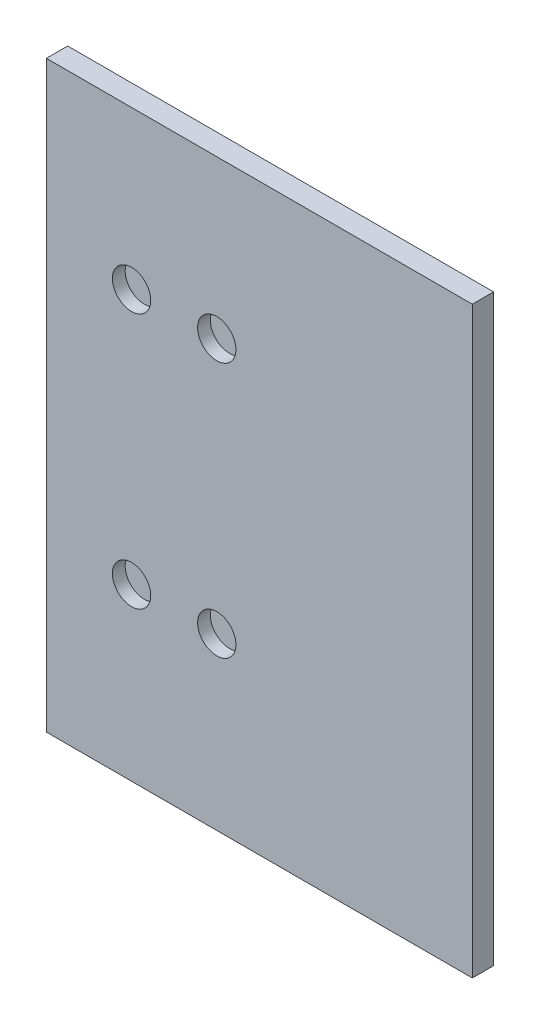
from build123d import *

# Parameters (mm, degrees)
BOSS_EXTRUDE1_DEPTH = 6.35
SKETCH3_R           = 5.715
CUT_EXTRUDE1_DEPTH  = 3.81
SKETCH2_R           = 5.715
CUT_EXTRUDE2_DEPTH  = 3.81


with BuildPart() as part:
    # Sketch1 → Boss-Extrude1 (new body)
    with BuildSketch(Plane.XY):
        Polygon((0, 173.99), (63.5, 173.99), (63.5, 0), (-63.5, 0), (-63.5, 173.99), align=None)
    extrude(amount=BOSS_EXTRUDE1_DEPTH)

    # Sketch3 → Cut-Extrude1 (cut)
    with BuildSketch(Plane.XY.offset(6.35)):
        with Locations((-38.1, 127)):
            Circle(SKETCH3_R)
        with Locations((-12.7, 127)):
            Circle(SKETCH3_R)
        with Locations((-38.1, 50.8)):
            Circle(SKETCH3_R)
        with Locations((-12.7, 50.8)):
            Circle(SKETCH3_R)
    extrude(amount=-CUT_EXTRUDE1_DEPTH, mode=Mode.SUBTRACT)

    # Sketch2 → Cut-Extrude2 (cut)
    with BuildSketch(Plane(origin=(0, 0, 0), x_dir=(-1, 0, 0), z_dir=(0, 0, -1))):
        with Locations((-43.064543118, 133.510265263)):
            Circle(SKETCH2_R)
        with Locations((-3.694543118, 133.510265263)):
            Circle(SKETCH2_R)
        with Locations((-43.064543118, 51.470265263)):
            Circle(SKETCH2_R)
        with Locations((-3.694543118, 51.470265263)):
            Circle(SKETCH2_R)
    extrude(amount=-CUT_EXTRUDE2_DEPTH, mode=Mode.SUBTRACT)


solid = part.part
